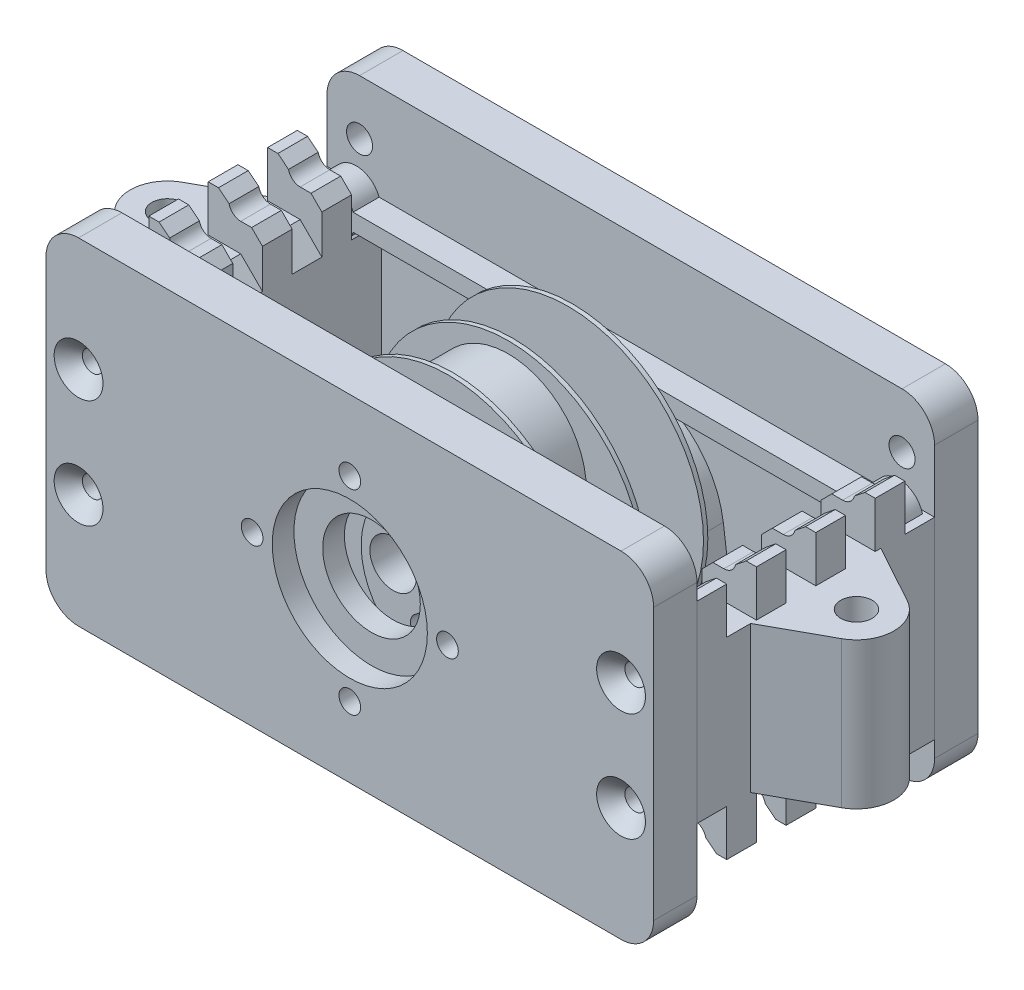
from build123d import *

# Parameters (mm, degrees)
SKETCH3_R                        = 8.9
SKETCH3_R_2                      = 7.4
SKETCH3_R_3                      = 2.25
SKETCH3_R_4                      = 1.25
BOSS_EXTRUDE1_DEPTH              = 2.4
BOSS_EXTRUDE3_START              = 1.2
BOSS_EXTRUDE3_DEPTH              = 0.8
SKETCH4_R                        = 2
CUT_EXTRUDE1_DEPTH               = 38.159722819
CIRPATTERN1_COUNT                = 4
CIRPATTERN1_ANGLE                = 23
CIRPATTERN1_THE_OTHER_WAY_COUNT  = 4
CIRPATTERN1_THE_OTHER_WAY_ANGLE  = 23
BOSS_EXTRUDE5_START              = -0.3
SKETCH5_W                        = 56
SKETCH5_H                        = 31
SKETCH5_R                        = 1.2
SKETCH5_R_2                      = 0.95
BOSS_EXTRUDE5_DEPTH              = 4
BOSS_EXTRUDE6_START              = -4.3
SKETCH5_2_R                      = 1.2
BOSS_EXTRUDE6_DEPTH              = 0.8
SKETCH6_R                        = 7.2
BOSS_EXTRUDE7_DEPTH              = 5.1
BOSS_EXTRUDE8_START              = 5.1
SKETCH6_4_R                      = 12.5
SKETCH6_4_R_2                    = 2.15
BOSS_EXTRUDE8_DEPTH              = 0.4
BOSS_EXTRUDE9_START              = 5.5
SKETCH6_5_R                      = 7.2
BOSS_EXTRUDE9_DEPTH              = 5.1
BOSS_EXTRUDE10_START             = 10.6
SKETCH6_6_R                      = 12.5
SKETCH6_6_R_2                    = 2.15
BOSS_EXTRUDE10_DEPTH             = 0.4
BOSS_EXTRUDE11_START             = 11
SKETCH6_7_R                      = 7.2
BOSS_EXTRUDE11_DEPTH             = 5.1
BOSS_EXTRUDE12_START             = 16.1
SKETCH6_8_R                      = 12.5
SKETCH6_8_R_2                    = 2.15
BOSS_EXTRUDE12_DEPTH             = 0.4
BOSS_EXTRUDE13_START             = 16.5
SKETCH6_9_R                      = 7.2
BOSS_EXTRUDE13_DEPTH             = 5.1
BOSS_EXTRUDE14_DEPTH             = 5
BOSS_EXTRUDE15_REACH             = 47.482
SKETCH8_R                        = 1.45
BOSS_EXTRUDE15_DIRECTION_2_REACH = 47.482
CUT_EXTRUDE3_DEPTH               = 51.235734133
CUT_EXTRUDE3_DEPTH_BACK          = 51.235734133
CUT_EXTRUDE8_DEPTH               = 51.235734133
CUT_EXTRUDE8_DEPTH_BACK          = 51.235734133
SKETCH5_4_R                      = 0.95
CHAMFER1_SIZE                    = 2
CHAMFER2_START                   = 2.4375
CHAMFER2_DEPTH                   = 19.1625
SKETCH10_3_R                     = 4.5
SKETCH10_3_R_2                   = 1
CUT_EXTRUDE5_DEPTH               = 4
CHAMFER3_SIZE                    = 1.3
SKETCH10_R                       = 7.15
SKETCH10_R_2                     = 4.5
CUT_EXTRUDE4_DEPTH               = 2
CUT_EXTRUDE6_START               = -29.9
SKETCH10_4_R                     = 4.5
CUT_EXTRUDE6_DEPTH               = 25.9
CHAMFER4_SIZE                    = 1.3
CHAMFER5_SIZE                    = 1.3
SKETCH11_R                       = 2.15
CUT_EXTRUDE7_DEPTH               = 3
FILLET2_R                        = 3
FILLET3_R                        = 3
CUT_EXTRUDE13_DEPTH              = 51.389274493
FILLET5_R                        = 1
CUT_EXTRUDE14_DEPTH              = 48.795700475
FILLET6_R                        = 1
CUT_EXTRUDE15_DEPTH              = 51.235734133
FILLET7_R                        = 1


with BuildPart() as part:
    # Sketch3 → Boss-Extrude1 (new body)
    # profile 1 of 6: a face of its own
    with BuildSketch(Plane.XY):
        with Locations((0, -4.25)):
            Circle(SKETCH3_R)
        with Locations((0, -4.25)):
            Circle(SKETCH3_R_2, mode=Mode.SUBTRACT)
    # profile 2 of 6: a face of its own
    with BuildSketch(Plane.XY):
        with BuildLine():
            Line((0.75, 5.4), (-0.75, 5.4))
            Line((-0.75, 5.4), (-0.75, 4.618342573))
            ThreePointArc((-0.75, 4.618342573), (0, 4.65), (0.75, 4.618342573))
            Line((0.75, 4.618342573), (0.75, 5.4))
        make_face()
    # profile 3 of 6: a face of its own
    with BuildSketch(Plane.XY):
        with BuildLine():
            Line((22.897025916, 7), (-22.897025916, 7))
            ThreePointArc((-22.897025916, 7), (-22.787061717, 6.606699096), (-22.75, 6.2))
            ThreePointArc((-22.75, 6.2), (-22.787061717, 5.793300904), (-22.897025916, 5.4))
            Line((-22.897025916, 5.4), (-0.75, 5.4))
            Line((-0.75, 5.4), (0.75, 5.4))
            Line((0.75, 5.4), (22.897025916, 5.4))
            ThreePointArc((22.897025916, 5.4), (22.75, 6.2), (22.897025916, 7))
        make_face()
    # profile 4 of 6: a face of its own
    with BuildSketch(Plane.XY):
        with Locations((25, 6.2)):
            Circle(SKETCH3_R_3)
        with Locations((25, 6.2)):
            Circle(SKETCH3_R_4, mode=Mode.SUBTRACT)
    # profile 5 of 6: a face of its own
    with BuildSketch(Plane.XY):
        with Locations((-25, 6.2)):
            Circle(SKETCH3_R_3)
        with Locations((-25, 6.2)):
            Circle(SKETCH3_R_4, mode=Mode.SUBTRACT)
    # profile 6 of 6: a face of its own
    with BuildSketch(Plane.XY):
        with BuildLine():
            ThreePointArc((8.9, -4.25), (-0.58208785, -13.130944417), (-8.823859266, -3.088316889))
            Line((-8.823859266, -3.088316889), (-11.023613388, -19.797108307))
            ThreePointArc((-11.023613388, -19.797108307), (-8.455932322, -20.791708378), (-5.800302422, -21.519613039))
            ThreePointArc((-5.800302422, -21.519613039), (0, -22.15), (5.800302422, -21.519613039))
            ThreePointArc((5.800302422, -21.519613039), (8.455932322, -20.791708378), (11.023613388, -19.797108307))
            Line((11.023613388, -19.797108307), (8.823859266, -3.088316889))
            ThreePointArc((8.823859266, -3.088316889), (8.880944417, -3.66791215), (8.9, -4.25))
        make_face()
    extrude(amount=BOSS_EXTRUDE1_DEPTH)


with BuildPart() as body_2:
    # Sketch3<4> → Boss-Extrude3 (new, symmetric)
    with BuildSketch(Plane.XY.offset(BOSS_EXTRUDE3_START)):
        with BuildLine():
            ThreePointArc((-5.800302422, -21.519613039), (-8.455932322, -20.791708378), (-11.023613388, -19.797108307))
            Line((-11.023613388, -19.797108307), (-11.430415847, -22.887079759))
            ThreePointArc((-11.430415847, -22.887079759), (0, -25.15), (11.430415847, -22.887079759))
            Line((11.430415847, -22.887079759), (11.023613388, -19.797108307))
            ThreePointArc((11.023613388, -19.797108307), (8.455932322, -20.791708378), (5.800302422, -21.519613039))
            ThreePointArc((5.800302422, -21.519613039), (0, -22.15), (-5.800302422, -21.519613039))
        make_face()
    extrude(amount=BOSS_EXTRUDE3_DEPTH, both=True)

    # Sketch4 → Cut-Extrude1 (cut, symmetric)
    with BuildSketch(Plane.XY):
        with Locations((0, -25.35)):
            Circle(SKETCH4_R)
    cut_extrude1 = extrude(amount=CUT_EXTRUDE1_DEPTH, both=True, mode=Mode.SUBTRACT)

    # CirPattern1: Cut-Extrude1 ×4 about axis
    cirpattern1_axis = Axis((0, 4.85, 0), (0, 0, 1))
    for i in range(1, CIRPATTERN1_COUNT):
        add(cut_extrude1.rotate(cirpattern1_axis, i * CIRPATTERN1_ANGLE / (CIRPATTERN1_COUNT - 1)), mode=Mode.SUBTRACT)

    # CirPattern1 the other way: Cut-Extrude1 ×4 about axis
    cirpattern1_the_other_way_axis = Axis((0, 4.85, 0), (0, 0, -1))
    for i in range(1, CIRPATTERN1_THE_OTHER_WAY_COUNT):
        add(cut_extrude1.rotate(cirpattern1_the_other_way_axis, i * CIRPATTERN1_THE_OTHER_WAY_ANGLE / (CIRPATTERN1_THE_OTHER_WAY_COUNT - 1)), mode=Mode.SUBTRACT)


with BuildPart() as body_3:
    # Sketch5 → Boss-Extrude5 (new body)
    with BuildSketch(Plane.XY.offset(BOSS_EXTRUDE5_START)):
        Rectangle(SKETCH5_W, SKETCH5_H)
        with Locations((-25, 10.45)):
            Circle(SKETCH5_R, mode=Mode.SUBTRACT)
        with Locations((25, 10.45)):
            Circle(SKETCH5_R, mode=Mode.SUBTRACT)
        with Locations(Location((25, -10.45, 0), (0, 0, 180))):
            Circle(SKETCH5_R, mode=Mode.SUBTRACT)
        with Locations(Location((-25, -10.45, 0), (0, 0, 180))):
            Circle(SKETCH5_R, mode=Mode.SUBTRACT)
        with Locations((-25, 5)):
            Circle(SKETCH5_R_2, mode=Mode.SUBTRACT)
        with Locations((-25, -5)):
            Circle(SKETCH5_R_2, mode=Mode.SUBTRACT)
        with Locations(Location((25, -5, 0), (0, 0, 180))):
            Circle(SKETCH5_R_2, mode=Mode.SUBTRACT)
        with Locations(Location((25, 5, 0), (0, 0, 180))):
            Circle(SKETCH5_R_2, mode=Mode.SUBTRACT)
    extrude(amount=-BOSS_EXTRUDE5_DEPTH)

    # Sketch5<2> → Boss-Extrude6 (add)
    with BuildSketch(Plane.XY.offset(BOSS_EXTRUDE6_START)):
        with Locations((-25, 10.45)):
            Circle(SKETCH5_2_R)
        with Locations(Location((-25, -10.45, 0), (0, 0, 180))):
            Circle(SKETCH5_2_R)
        with Locations((25, 10.45)):
            Circle(SKETCH5_2_R)
        with Locations(Location((25, -10.45, 0), (0, 0, 180))):
            Circle(SKETCH5_2_R)
    extrude(amount=BOSS_EXTRUDE6_DEPTH)


with BuildPart() as body_4:
    # Sketch6 → Boss-Extrude7 (new body)
    with BuildSketch(Plane.XY):
        with Locations((0, -4.25)):
            Circle(SKETCH6_R)
        with BuildLine():
            Line((-1.587450787, 1.45), (1.587450787, 1.45))
            ThreePointArc((1.587450787, 1.45), (0, -2.15), (-1.587450787, 1.45))
        make_face(mode=Mode.SUBTRACT)
    extrude(amount=BOSS_EXTRUDE7_DEPTH)

    # Sketch17 → Cut-Extrude15 (cut, through all)
    with BuildSketch(Plane(origin=(0, 0, 0), x_dir=(-1, 0, 0), z_dir=(0, 0, -1))):
        with BuildLine():
            ThreePointArc((-3.148037451, -0.111176471), (-2.309784108, -8.908851508), (5.2, -4.25))
            ThreePointArc((5.2, -4.25), (4.658851508, -1.940215892), (3.148037451, -0.111176471))
            ThreePointArc((3.148037451, -0.111176471), (0, -3.15), (-3.148037451, -0.111176471))
        make_face()
    extrude(amount=-CUT_EXTRUDE15_DEPTH, mode=Mode.SUBTRACT)

    # Fillet7
    fillet7_edges = [body_4.edges().sort_by_distance(p)[0] for p in [
        (3.148037451, -0.111176471, 2.55),
        (-3.148037451, -0.111176471, 2.55),
    ]]
    fillet(fillet7_edges, radius=FILLET7_R)


with BuildPart() as body_5:
    # Sketch6<4> → Boss-Extrude8 (new body)
    with BuildSketch(Plane.XY.offset(BOSS_EXTRUDE8_START)):
        Circle(SKETCH6_4_R)
        Circle(SKETCH6_4_R_2, mode=Mode.SUBTRACT)
    extrude(amount=BOSS_EXTRUDE8_DEPTH)


with BuildPart() as body_6:
    # Sketch6<5> → Boss-Extrude9 (new body)
    with BuildSketch(Plane.XY.offset(BOSS_EXTRUDE9_START)):
        with Locations((-4.25, 0)):
            Circle(SKETCH6_5_R)
        with BuildLine():
            Line((-1.587450787, 1.45), (1.587450787, 1.45))
            ThreePointArc((1.587450787, 1.45), (0, -2.15), (-1.587450787, 1.45))
        make_face(mode=Mode.SUBTRACT)
    extrude(amount=BOSS_EXTRUDE9_DEPTH)


with BuildPart() as body_7:
    # Sketch6<6> → Boss-Extrude10 (new body)
    with BuildSketch(Plane.XY.offset(BOSS_EXTRUDE10_START)):
        Circle(SKETCH6_6_R)
        Circle(SKETCH6_6_R_2, mode=Mode.SUBTRACT)
    extrude(amount=BOSS_EXTRUDE10_DEPTH)


with BuildPart() as body_8:
    # Sketch6<7> → Boss-Extrude11 (new body)
    with BuildSketch(Plane.XY.offset(BOSS_EXTRUDE11_START)):
        with Locations((0, 4.25)):
            Circle(SKETCH6_7_R)
        with BuildLine():
            Line((-1.587450787, 1.45), (1.587450787, 1.45))
            ThreePointArc((1.587450787, 1.45), (0, -2.15), (-1.587450787, 1.45))
        make_face(mode=Mode.SUBTRACT)
    extrude(amount=BOSS_EXTRUDE11_DEPTH)

    # Sketch16 → Cut-Extrude14 (cut, through all)
    with BuildSketch(Plane.XY.offset(16.1)):
        with BuildLine():
            ThreePointArc((3.614028032, 0.511176471), (4.787115299, 2.21935303), (5.2, 4.25))
            ThreePointArc((5.2, 4.25), (-2.03064697, 9.037115299), (-3.614028032, 0.511176471))
            ThreePointArc((-3.614028032, 0.511176471), (-3.30180916, 1.555813701), (-2.694974591, 2.461627907))
            ThreePointArc((-2.694974591, 2.461627907), (0, 3.65), (2.694974591, 2.461627907))
            ThreePointArc((2.694974591, 2.461627907), (3.30180916, 1.555813701), (3.614028032, 0.511176471))
        make_face()
    extrude(amount=-CUT_EXTRUDE14_DEPTH, mode=Mode.SUBTRACT)

    # Fillet6
    fillet6_edges = [body_8.edges().sort_by_distance(p)[0] for p in [
        (3.614028032, 0.511176471, 13.55),
        (-3.614028032, 0.511176471, 13.55),
    ]]
    fillet(fillet6_edges, radius=FILLET6_R)


with BuildPart() as body_9:
    # Sketch6<8> → Boss-Extrude12 (new body)
    with BuildSketch(Plane.XY.offset(BOSS_EXTRUDE12_START)):
        Circle(SKETCH6_8_R)
        Circle(SKETCH6_8_R_2, mode=Mode.SUBTRACT)
    extrude(amount=BOSS_EXTRUDE12_DEPTH)


with BuildPart() as body_10:
    # Sketch6<9> → Boss-Extrude13 (new body)
    with BuildSketch(Plane.XY.offset(BOSS_EXTRUDE13_START)):
        with Locations((4.25, 0)):
            Circle(SKETCH6_9_R)
        with BuildLine():
            Line((-1.587450787, 1.45), (1.587450787, 1.45))
            ThreePointArc((1.587450787, 1.45), (0, -2.15), (-1.587450787, 1.45))
        make_face(mode=Mode.SUBTRACT)
    extrude(amount=BOSS_EXTRUDE13_DEPTH)

    # Sketch11 → Cut-Extrude7 (cut)
    with BuildSketch(Plane.XY.offset(21.6)):
        with Locations(Location((0, 0, 0), (0, 0, 137.590982222))):
            Circle(SKETCH11_R)
    extrude(amount=-CUT_EXTRUDE7_DEPTH, mode=Mode.SUBTRACT)

    # Sketch15 → Cut-Extrude13 (cut, through all)
    with BuildSketch(Plane.XY.offset(21.6)):
        with BuildLine():
            ThreePointArc((0.511176471, -3.614028032), (6.199117447, -4.820885933), (9.45, 0))
            ThreePointArc((9.45, 0), (6.199117447, 4.820885933), (0.511176471, 3.614028032))
            ThreePointArc((0.511176471, 3.614028032), (2.755748004, 2.393397782), (3.65, 0))
            ThreePointArc((3.65, 0), (2.755748004, -2.393397782), (0.511176471, -3.614028032))
        make_face()
    extrude(amount=-CUT_EXTRUDE13_DEPTH, mode=Mode.SUBTRACT)

    # Fillet5
    fillet5_edges = [body_10.edges().sort_by_distance(p)[0] for p in [
        (0.511176471, -3.614028032, 19.05),
        (0.511176471, 3.614028032, 19.05),
    ]]
    fillet(fillet5_edges, radius=FILLET5_R)


with BuildPart() as body_11:
    # Mirror1: mirrored copy
    add(body_3.part.mirror(Plane.XY.offset(10.65)))

    # Sketch10<3> → Cut-Extrude5 (cut)
    with BuildSketch(Plane.XY.offset(25.6)):
        Circle(SKETCH10_3_R)
        with Locations((-9, 0)):
            Circle(SKETCH10_3_R_2)
        with Locations((0, 9)):
            Circle(SKETCH10_3_R_2)
        with Locations((9, 0)):
            Circle(SKETCH10_3_R_2)
        with Locations((0, -9)):
            Circle(SKETCH10_3_R_2)
    extrude(amount=-CUT_EXTRUDE5_DEPTH, mode=Mode.SUBTRACT)

    # Chamfer3
    chamfer3_edges = [body_11.edges().sort_by_distance(p)[0] for p in [
        (-10, 0, 21.6),
        (-1, 9, 21.6),
        (8, 0, 21.6),
        (-1, -9, 21.6),
    ]]
    chamfer(chamfer3_edges, length=CHAMFER3_SIZE)

    # Sketch10 → Cut-Extrude4 (cut)
    with BuildSketch(Plane.XY.offset(25.6)):
        Circle(SKETCH10_R)
        Circle(SKETCH10_R_2, mode=Mode.SUBTRACT)
    extrude(amount=-CUT_EXTRUDE4_DEPTH, mode=Mode.SUBTRACT)

    # Chamfer5
    chamfer5_edges = [body_11.edges().sort_by_distance(p)[0] for p in [
        (-25.95, 5, 25.6),
        (-25.95, -5, 25.6),
        (25.95, -5, 25.6),
        (25.95, 5, 25.6),
    ]]
    chamfer(chamfer5_edges, length=CHAMFER5_SIZE)

    # Fillet2
    fillet2_edges = [body_11.edges().sort_by_distance(p)[0] for p in [
        (28, 15.5, 23.6),
        (28, -15.5, 23.6),
        (-28, -15.5, 23.6),
        (-28, 15.5, 23.6),
    ]]
    fillet(fillet2_edges, radius=FILLET2_R)


with BuildPart() as body_12:
    # Sketch7 → Boss-Extrude14 (new body)
    with BuildSketch(Plane(origin=(28, 0, 0), x_dir=(0, 0, -1), z_dir=(1, 0, 0))):
        Polygon((-18.8625, 11), (-21.6, 11), (-21.6, -6.75), (-18.8625, -6.75), (-18.8625, -11), (-16.125, -11), (-16.125, -6.75), (-13.3875, -6.75), (-13.3875, -11), (-10.65, -11), (-10.65, -6.75), (-7.9125, -6.75), (-7.9125, -11), (-5.175, -11), (-5.175, -6.75), (-2.4375, -6.75), (-2.4375, -11), (0.3, -11), (0.3, 6.75), (-2.4375, 6.75), (-2.4375, 11), (-5.175, 11), (-5.175, 6.75), (-7.9125, 6.75), (-7.9125, 11), (-10.65, 11), (-10.65, 6.75), (-13.3875, 6.75), (-13.3875, 11), (-16.125, 11), (-16.125, 6.75), (-18.8625, 6.75), align=None)
    extrude(amount=-BOSS_EXTRUDE14_DEPTH)

    # Boss-Extrude15: up to this face of the body (flat: up to its plane)
    boss_extrude15_end = Plane(body_12.part.faces().sort_by_distance((25.5, 6.75, 6.54375))[0])
    # Sketch8 → Boss-Extrude15 (add, up to the picked face)
    with BuildSketch(Plane(origin=(0, 0, 0), x_dir=(1, 0, 0), z_dir=(0, 1, 0)), mode=Mode.PRIVATE) as boss_extrude15_sk1:
        with BuildLine():
            Line((33.412668691, -7.627082068), (28, -4.65))
            Line((28, -4.65), (28, -16.65))
            Line((28, -16.65), (33.412668691, -13.672917932))
            ThreePointArc((33.412668691, -13.672917932), (35.2, -10.65), (33.412668691, -7.627082068))
        make_face()
        with Locations(Location((31.75, -10.65, 0), (0, 0, 90))):
            Circle(SKETCH8_R, mode=Mode.SUBTRACT)
    boss_extrude15_tool1 = split(extrude(boss_extrude15_sk1.sketch, amount=BOSS_EXTRUDE15_REACH, mode=Mode.PRIVATE), bisect_by=boss_extrude15_end, keep=Keep.BOTH, mode=Mode.PRIVATE)
    add(boss_extrude15_tool1.solids().sort_by(Axis((35.060057, 0, 10.65), (0, 1, 0)))[0])

    # Boss-Extrude15 direction 2: up to this face of the body (flat: up to its plane)
    boss_extrude15_direction_2_end = Plane(body_12.part.faces().sort_by_distance((25.5, -6.75, 3.80625))[0])
    # Sketch8 → Boss-Extrude15 direction 2 (add, up to the picked face)
    with BuildSketch(Plane(origin=(0, 0, 0), x_dir=(1, 0, 0), z_dir=(0, 1, 0)), mode=Mode.PRIVATE) as boss_extrude15_direction_2_sk1:
        with BuildLine():
            Line((33.412668691, -7.627082068), (28, -4.65))
            Line((28, -4.65), (28, -16.65))
            Line((28, -16.65), (33.412668691, -13.672917932))
            ThreePointArc((33.412668691, -13.672917932), (35.2, -10.65), (33.412668691, -7.627082068))
        make_face()
        with Locations(Location((31.75, -10.65, 0), (0, 0, 90))):
            Circle(SKETCH8_R, mode=Mode.SUBTRACT)
    boss_extrude15_direction_2_tool1 = split(extrude(boss_extrude15_direction_2_sk1.sketch, amount=-BOSS_EXTRUDE15_DIRECTION_2_REACH, mode=Mode.PRIVATE), bisect_by=boss_extrude15_direction_2_end, keep=Keep.BOTH, mode=Mode.PRIVATE)
    add(boss_extrude15_direction_2_tool1.solids().sort_by(Axis((35.060057, 0, 10.65), (0, -1, 0)))[0])

    # Sketch9 → Cut-Extrude3 (cut, two sides: drawn at the far end of the back side and taken through both)
    with BuildSketch(Plane.XY.offset(-CUT_EXTRUDE3_DEPTH_BACK)):
        with BuildLine():
            Line((26.1, 10.45), (26.1, 12.5))
            Line((26.1, 12.5), (23, 12.5))
            Line((23, 12.5), (23, 9.35))
            Line((23, 9.35), (25, 9.35))
            ThreePointArc((25, 9.35), (25.777817459, 9.672182541), (26.1, 10.45))
        make_face()
        with BuildLine():
            Line((23, -9.35), (25, -9.35))
            ThreePointArc((25, -9.35), (25.777817459, -9.672182541), (26.1, -10.45))
            Line((26.1, -10.45), (26.1, -12.5))
            Line((26.1, -12.5), (23, -12.5))
            Line((23, -12.5), (23, -9.35))
        make_face()
    extrude(amount=CUT_EXTRUDE3_DEPTH + CUT_EXTRUDE3_DEPTH_BACK, mode=Mode.SUBTRACT)

    # Sketch5<4> → Cut-Extrude8 (cut, two sides: drawn at the far end of the back side and taken through both)
    with BuildSketch(Plane.XY.offset(-CUT_EXTRUDE8_DEPTH_BACK)):
        with Locations(Location((25, -5, 0), (0, 0, 270))):
            Circle(SKETCH5_4_R)
        with Locations(Location((25, 5, 0), (0, 0, 270))):
            Circle(SKETCH5_4_R)
    extrude(amount=CUT_EXTRUDE8_DEPTH + CUT_EXTRUDE8_DEPTH_BACK, mode=Mode.SUBTRACT)

    # Chamfer1
    chamfer1_edges = [body_12.edges().sort_by_distance(p)[0] for p in [
        (23, -6.75, 14.75625),
        (23, -6.75, 9.28125),
        (23, -6.75, 3.80625),
        (23, 6.75, 6.54375),
        (23, 6.75, 12.01875),
        (23, 6.75, 1.06875),
        (23, 6.75, 17.49375),
        (23, -6.75, 20.23125),
    ]]
    chamfer(chamfer1_edges, length=CHAMFER1_SIZE)

    # Chamfer2: read off the stored shape, not the designer's step
    # Chamfer2 outline → Chamfer2 (cut)
    with BuildSketch(Plane.XY.offset(CHAMFER2_START)):
        with BuildLine():
            Line((27.05121915, -11), (26.074448126, -10.214285714))
            ThreePointArc((26.074448126, -10.214285714), (26.093593375, -10.331452412), (26.1, -10.45))
            Line((26.1, -10.45), (26.1, -11))
            Line((26.1, -11), (27.05121915, -11))
        make_face()
        Polygon((24, -9.35), (23, -8.35), (23, -9.35), align=None)
        with BuildLine():
            ThreePointArc((26.1, 10.45), (26.093593375, 10.331452412), (26.074448126, 10.214285714))
            Line((26.074448126, 10.214285714), (27.05121915, 11))
            Line((27.05121915, 11), (26.1, 11))
            Line((26.1, 11), (26.1, 10.45))
        make_face()
        Polygon((23, 9.35), (23, 8.35), (24, 9.35), align=None)
    extrude(amount=CHAMFER2_DEPTH, mode=Mode.SUBTRACT)


with BuildPart() as body_13:
    # Mirror2: mirrored copy
    add(body_12.part.mirror(Plane(origin=(0, 0, 0), x_dir=(0, 0, 1), z_dir=(1, 0, 0))))


with BuildPart() as body_3_1:
    add(body_3.part)

    # Sketch10<4> → Cut-Extrude6 (cut)
    with BuildSketch(Plane.XY.offset(25.6).offset(CUT_EXTRUDE6_START)):
        Circle(SKETCH10_4_R)
    extrude(amount=CUT_EXTRUDE6_DEPTH, mode=Mode.SUBTRACT)

    # Chamfer4
    chamfer4_edges = [body_3_1.edges().sort_by_distance(p)[0] for p in [
        (-25.95, 5, -4.3),
        (-25.95, -5, -4.3),
        (25.95, -5, -4.3),
        (25.95, 5, -4.3),
    ]]
    chamfer(chamfer4_edges, length=CHAMFER4_SIZE)

    # Fillet3
    fillet3_edges = [body_3_1.edges().sort_by_distance(p)[0] for p in [
        (28, 15.5, -2.3),
        (28, -15.5, -2.3),
        (-28, -15.5, -2.3),
        (-28, 15.5, -2.3),
    ]]
    fillet(fillet3_edges, radius=FILLET3_R)


solid = Compound([part.part, body_2.part, body_4.part, body_5.part, body_6.part, body_7.part, body_8.part, body_9.part, body_10.part, body_11.part, body_12.part, body_13.part, body_3_1.part])
